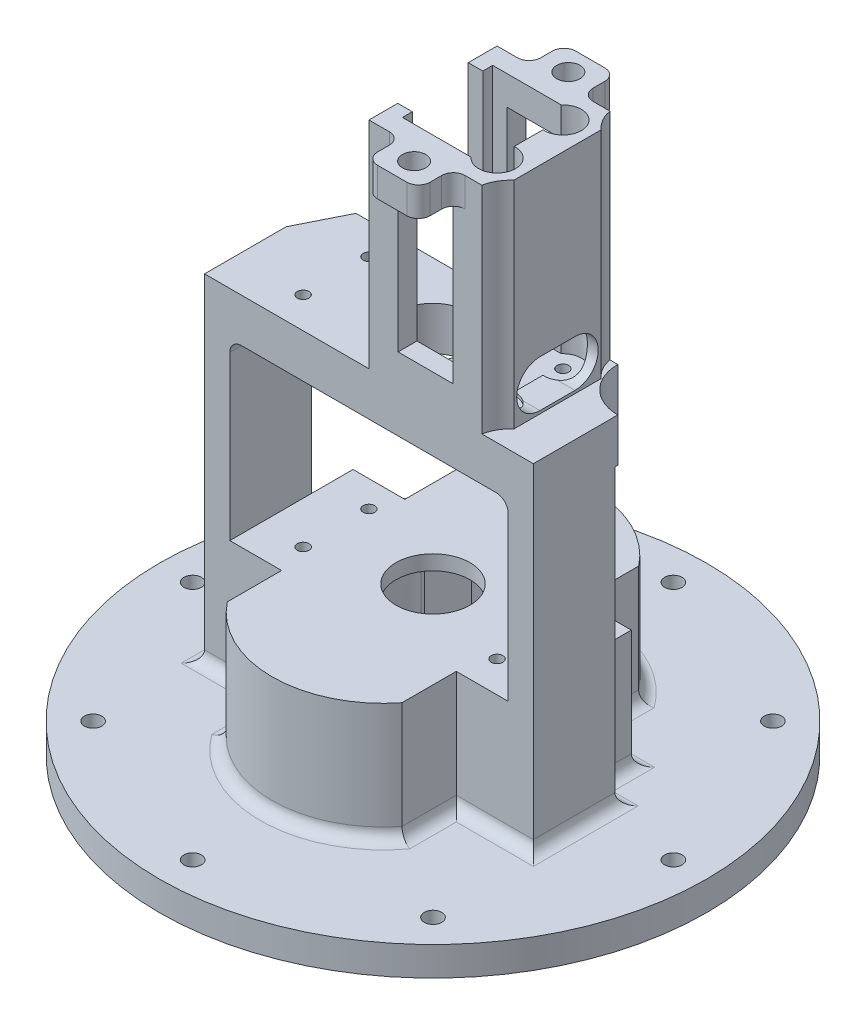
from build123d import *

# Parameters (mm, degrees)
SKETCH2_W                = 8.89
SKETCH2_H                = 20.32
SKETCH2_R                = 12.7
BOSS_EXTRUDE2_DEPTH      = 25.4
SKETCH4_R                = 12.7
CUT_EXTRUDE1_DEPTH       = 22.86
BOSS_EXTRUDE3_DEPTH      = 22.86
FILLET2_R                = 0.508
SKETCH6_R                = 46.99
BOSS_EXTRUDE4_DEPTH      = 5
SKETCH7_R                = 25.781
CUT_EXTRUDE2_DEPTH       = 2
BOSS_EXTRUDE5_START      = -2.54
SKETCH8_R                = 12.7
SKETCH8_R_2              = 6.35
BOSS_EXTRUDE5_DEPTH      = 2.54
SKETCH16_R               = 1.5
CUT_EXTRUDE5_DEPTH       = 72.142674957
BOSS_EXTRUDE6_DEPTH      = 20.4
BOSS_EXTRUDE6_2_DEPTH    = 20.4
SKETCH21_4_W             = 4.34
SKETCH21_4_H             = 14
BOSS_EXTRUDE7_DEPTH      = 30
SKETCH23_R               = 6
BOSS_EXTRUDE8_DEPTH      = 7.5
BOSS_EXTRUDE9_DEPTH      = 7.5
BOSS_EXTRUDE10_DEPTH     = 37
SKETCH30_W               = 9.4
SKETCH30_H               = 27
CUT_EXTRUDE9_DEPTH       = 10
SKETCH31_W               = 9.4
SKETCH31_H               = 27
CUT_EXTRUDE10_DEPTH      = 10
SKETCH28_W               = 9
SKETCH28_H               = 6
SKETCH28_R               = 2
BOSS_EXTRUDE11_DEPTH     = 5
CUT_EXTRUDE16_DEPTH      = 51.054
CUT_EXTRUDE16_DEPTH_BACK = 47
SKETCH32_5_R             = 1
BOSS_EXTRUDE14_DEPTH     = 37
FILLET1_START            = 55.4
FILLET1_DEPTH            = 45.6
FILLET1_START_2          = 94.9
FILLET1_2_DEPTH          = 5
SKETCH39_R               = 3.175
CUT_EXTRUDE18_DEPTH      = 50
SKETCH14_R               = 34.9758
SKETCH14_R_2             = 33.1978
CUT_EXTRUDE19_DEPTH      = 0.508
FILLET3_R                = 2
SKETCH41_W               = 20.57859909
SKETCH41_H               = 5.977801458
CUT_EXTRUDE20_DEPTH      = 2.5
CUT_EXTRUDE23_REACH      = 131.866
FILLET4_R                = 2


with BuildPart() as part:
    # Sketch2 → Boss-Extrude2 (new body)
    # profile 1 of 3: a face of its own
    with BuildSketch(Plane(origin=(0, 0, 0), x_dir=(1, 0, 0), z_dir=(0, 1, 0))):
        with Locations((-19.445, 0)):
            Rectangle(SKETCH2_W, SKETCH2_H)
    # profile 2 of 3: a face of its own
    with BuildSketch(Plane(origin=(0, 0, 0), x_dir=(1, 0, 0), z_dir=(0, 1, 0))):
        with Locations((19.445, 0)):
            Rectangle(SKETCH2_W, SKETCH2_H)
    # profile 3 of 3: a face of its own
    with BuildSketch(Plane(origin=(0, 0, 0), x_dir=(1, 0, 0), z_dir=(0, 1, 0))):
        with BuildLine():
            Line((-15, 20.32), (-15, 10.16))
            Line((-15, 10.16), (-15, -10.16))
            Line((-15, -10.16), (-15, -20.32))
            ThreePointArc((-15, -20.32), (0, -27.626810484), (15, -20.32))
            Line((15, -20.32), (15, -10.16))
            Line((15, -10.16), (15, 10.16))
            Line((15, 10.16), (15, 20.32))
            ThreePointArc((15, 20.32), (0, 27.626810484), (-15, 20.32))
        make_face()
        with Locations(Location((0, 0, 0), (0, 0, 270))):
            Circle(SKETCH2_R, mode=Mode.SUBTRACT)
    extrude(amount=BOSS_EXTRUDE2_DEPTH)

    # Sketch4 → Cut-Extrude1 (cut)
    with BuildSketch(Plane.XZ):
        with BuildLine():
            Line((-12.968, 19.596942063), (-12.968, -19.596942063))
            ThreePointArc((-12.968, -19.596942063), (0, -25.594810484), (12.968, -19.596942063))
            Line((12.968, -19.596942063), (12.968, 19.596942063))
            ThreePointArc((12.968, 19.596942063), (0, 25.594810484), (-12.968, 19.596942063))
        make_face()
        with Locations(Location((0, 0, 0), (0, 0, 270))):
            Circle(SKETCH4_R, mode=Mode.SUBTRACT)
    extrude(amount=-CUT_EXTRUDE1_DEPTH, mode=Mode.SUBTRACT)

    # Sketch5 → Boss-Extrude3 (add)
    with BuildSketch(Plane.XZ.offset(-22.86)):
        with BuildLine():
            Line((-12.968, -8.89), (-9.416496164, -8.89))
            ThreePointArc((-9.416496164, -8.89), (-12.95, 0), (-9.416496164, 8.89))
            Line((-9.416496164, 8.89), (-12.968, 8.89))
            Line((-12.968, 8.89), (-12.968, -8.89))
        make_face()
        with BuildLine():
            Line((9.416496164, -8.89), (12.968, -8.89))
            Line((12.968, -8.89), (12.968, 8.89))
            Line((12.968, 8.89), (9.416496164, 8.89))
            ThreePointArc((9.416496164, 8.89), (12.034245413, 4.783245482), (12.95, 0))
            ThreePointArc((12.95, 0), (12.034245413, -4.783245482), (9.416496164, -8.89))
        make_face()
    extrude(amount=BOSS_EXTRUDE3_DEPTH)

    # Fillet2
    fillet2_edges = [part.edges().sort_by_distance(p)[0] for p in [
        (-9.416496164, 11.43, 8.89),
        (-9.416496164, 11.43, -8.89),
        (9.416496164, 11.43, 8.89),
        (9.416496164, 11.43, -8.89),
    ]]
    fillet(fillet2_edges, radius=FILLET2_R)

    # Sketch6 → Boss-Extrude4 (add)
    with BuildSketch(Plane(origin=(0, 0, 0), x_dir=(1, 0, 0), z_dir=(0, 1, 0))):
        with Locations(Location((0, 0, 0), (0, 0, 270))):
            Circle(SKETCH6_R)
        with BuildLine():
            Line((-23.89, 10.16), (-15, 10.16))
            Line((-15, 10.16), (-15, 20.32))
            ThreePointArc((-15, 20.32), (0, 27.626810484), (15, 20.32))
            Line((15, 20.32), (15, 10.16))
            Line((15, 10.16), (23.89, 10.16))
            Line((23.89, 10.16), (23.89, -10.16))
            Line((23.89, -10.16), (15, -10.16))
            Line((15, -10.16), (15, -20.32))
            ThreePointArc((15, -20.32), (0, -27.626810484), (-15, -20.32))
            Line((-15, -20.32), (-15, -10.16))
            Line((-15, -10.16), (-23.89, -10.16))
            Line((-23.89, -10.16), (-23.89, 10.16))
        make_face(mode=Mode.SUBTRACT)
    extrude(amount=BOSS_EXTRUDE4_DEPTH)

    # Sketch7 → Cut-Extrude2 (cut)
    with BuildSketch(Plane.XZ):
        with Locations(Location((0, 0, 0), (0, 0, 270))):
            Circle(SKETCH7_R)
    extrude(amount=-CUT_EXTRUDE2_DEPTH, mode=Mode.SUBTRACT)

    # Sketch8 → Boss-Extrude5 (add)
    with BuildSketch(Plane(origin=(0, 25.4, 0), x_dir=(1, 0, 0), z_dir=(0, 1, 0)).offset(BOSS_EXTRUDE5_START)):
        Circle(SKETCH8_R)
        with Locations(Location((0, 0, 0), (0, 0, 270))):
            Circle(SKETCH8_R_2, mode=Mode.SUBTRACT)
    extrude(amount=BOSS_EXTRUDE5_DEPTH)

    # Sketch16 → Cut-Extrude5 (cut, through all)
    with BuildSketch(Plane.XZ):
        with Locations(Location((0, 41.275, 0), (0, 0, 270))):
            Circle(SKETCH16_R)
        with Locations(Location((29.185832393, 29.185832393, 0), (0, 0, 270))):
            Circle(SKETCH16_R)
        with Locations(Location((41.275, 0, 0), (0, 0, 270))):
            Circle(SKETCH16_R)
        with Locations(Location((29.185832393, -29.185832393, 0), (0, 0, 270))):
            Circle(SKETCH16_R)
        with Locations(Location((0, -41.275, 0), (0, 0, 270))):
            Circle(SKETCH16_R)
        with Locations(Location((-29.185832393, -29.185832393, 0), (0, 0, 270))):
            Circle(SKETCH16_R)
        with Locations(Location((-41.275, 0, 0), (0, 0, 270))):
            Circle(SKETCH16_R)
        with Locations(Location((-29.185832393, 29.185832393, 0), (0, 0, 270))):
            Circle(SKETCH16_R)
    extrude(amount=-CUT_EXTRUDE5_DEPTH, mode=Mode.SUBTRACT)



with BuildPart() as body_2:
    # Sketch21 → Boss-Extrude6 (new body)
    with BuildSketch(Plane(origin=(0, 25.4, 0), x_dir=(1, 0, 0), z_dir=(0, 1, 0))):
        Polygon((-23.89, 3), (-28.23, 3), (-28.23, -11), (-15, -11), (-15, -10.16), (-23.89, -10.16), align=None)
    extrude(amount=-BOSS_EXTRUDE6_DEPTH)


with BuildPart() as body_3:
    # Sketch21 → Boss-Extrude6 2 (new body)
    with BuildSketch(Plane(origin=(0, 25.4, 0), x_dir=(1, 0, 0), z_dir=(0, 1, 0))):
        Polygon((15, -10.16), (15, -11), (28.23, -11), (28.23, 3), (23.89, 3), (23.89, -10.16), align=None)
    extrude(amount=-BOSS_EXTRUDE6_2_DEPTH)


with BuildPart() as part_1:
    add(part.part)

    add(body_2.part)  # Boss-Extrude7 merges body 2

    add(body_3.part)  # Boss-Extrude7 merges body 3
    # Sketch21<4> → Boss-Extrude7 (add)
    with BuildSketch(Plane(origin=(0, 25.4, 0), x_dir=(1, 0, 0), z_dir=(0, 1, 0))):
        with Locations((-26.06, -4)):
            Rectangle(SKETCH21_4_W, SKETCH21_4_H)
        with Locations((26.06, -4)):
            Rectangle(SKETCH21_4_W, SKETCH21_4_H)
    extrude(amount=BOSS_EXTRUDE7_DEPTH)

    # Sketch23 → Boss-Extrude8 (add)
    with BuildSketch(Plane(origin=(0, 55.4, 0), x_dir=(1, 0, 0), z_dir=(0, 1, 0))):
        with BuildLine():
            Line((-28.23, -11), (28.23, -11))
            Line((28.23, -11), (28.23, 3.5))
            ThreePointArc((28.23, 3.5), (22.926699141, 5.696699141), (20.73, 11))
            Line((20.73, 11), (-24.23, 11))
            Line((-24.23, 11), (-28.23, 3))
            Line((-28.23, 3), (-28.23, -11))
        make_face()
        with Locations(Location((0, 0, 0), (0, 0, 270))):
            Circle(SKETCH23_R, mode=Mode.SUBTRACT)
    extrude(amount=BOSS_EXTRUDE8_DEPTH)

    # Sketch27 → Boss-Extrude9 (add)
    with BuildSketch(Plane.XZ.offset(-55.4)):
        with BuildLine():
            Line((28.23, -3.5), (28.23, -1.976))
            ThreePointArc((28.23, -1.976), (21.946068407, -4.659247122), (19.4, -11))
            Line((19.4, -11), (20.73, -11))
            ThreePointArc((20.73, -11), (22.926699141, -5.696699141), (28.23, -3.5))
        make_face()
    extrude(amount=-BOSS_EXTRUDE9_DEPTH)

    # Sketch25 → Boss-Extrude10 (add)
    with BuildSketch(Plane(origin=(0, 62.9, 0), x_dir=(1, 0, 0), z_dir=(0, 1, 0))):
        Polygon((0, 11), (19.4, 11), (19.4, -11), (0, -11), (0, -6.05), (2.5, -6.05), (2.5, -7.75), (16.4, -7.75), (16.4, 7.75), (2.5, 7.75), (2.5, 6.05), (0, 6.05), align=None)
    extrude(amount=BOSS_EXTRUDE10_DEPTH)

    # Sketch30 → Cut-Extrude9 (cut)
    with BuildSketch(Plane.XY.offset(11)):
        with Locations((9.7, 81.4)):
            Rectangle(SKETCH30_W, SKETCH30_H)
    extrude(amount=-CUT_EXTRUDE9_DEPTH, mode=Mode.SUBTRACT)

    # Sketch31 → Cut-Extrude10 (cut)
    with BuildSketch(Plane(origin=(0, 0, -11), x_dir=(-1, 0, 0), z_dir=(0, 0, -1))):
        with Locations((-9.7, 81.4)):
            Rectangle(SKETCH31_W, SKETCH31_H)
    extrude(amount=-CUT_EXTRUDE10_DEPTH, mode=Mode.SUBTRACT)

    # Sketch28 → Boss-Extrude11 (add)
    # profile 1 of 2: a face of its own
    with BuildSketch(Plane(origin=(0, 99.9, 0), x_dir=(1, 0, 0), z_dir=(0, 1, 0))):
        with Locations((10, 14)):
            Rectangle(SKETCH28_W, SKETCH28_H)
        with Locations(Location((10, 13.25, 0), (0, 0, 270))):
            Circle(SKETCH28_R, mode=Mode.SUBTRACT)
    # profile 2 of 2: a face of its own
    with BuildSketch(Plane(origin=(0, 99.9, 0), x_dir=(1, 0, 0), z_dir=(0, 1, 0))):
        with Locations((10, -14)):
            Rectangle(SKETCH28_W, SKETCH28_H)
        with Locations(Location((10, -13.25, 0), (0, 0, 90))):
            Circle(SKETCH28_R, mode=Mode.SUBTRACT)
    extrude(amount=-BOSS_EXTRUDE11_DEPTH)

    # Sketch32<5> → Cut-Extrude16 (cut, two sides: drawn at the far end of the back side and taken through both)
    with BuildSketch(Plane(origin=(0, 62.9, 0), x_dir=(1, 0, 0), z_dir=(0, 1, 0)).offset(-CUT_EXTRUDE16_DEPTH_BACK)):
        with Locations(Location((-16.65, 5.65, 0), (0, 0, 270))):
            Circle(SKETCH32_5_R)
        with Locations(Location((-16.65, -5.65, 0), (0, 0, 270))):
            Circle(SKETCH32_5_R)
        with Locations(Location((16.65, -5.65, 0), (0, 0, 104.477512186))):
            Circle(SKETCH32_5_R)
        with Locations(Location((16.65, 5.65, 0), (0, 0, 104.477512186))):
            Circle(SKETCH32_5_R)
    extrude(amount=CUT_EXTRUDE16_DEPTH + CUT_EXTRUDE16_DEPTH_BACK, mode=Mode.SUBTRACT)

    # Sketch35 → Boss-Extrude14 (add)
    with BuildSketch(Plane(origin=(0, 99.9, 0), x_dir=(1, 0, 0), z_dir=(0, 1, 0))):
        with BuildLine():
            Line((21.4, 7.471922323), (21.4, -7.528077677))
            ThreePointArc((21.4, -7.528077677), (20.101621006, -9.092157692), (19.4, -11))
            Line((19.4, -11), (19.4, 10.943844647))
            ThreePointArc((19.4, 10.943844647), (20.101621006, 9.036002339), (21.4, 7.471922323))
        make_face()
    extrude(amount=-BOSS_EXTRUDE14_DEPTH)

    # Fillet1: read off the stored shape, not the designer's step
    # Fillet1 outline → Fillet1 (cut)
    with BuildSketch(Plane(origin=(0, 0, 0), x_dir=(1, 0, 0), z_dir=(0, 1, 0)).offset(FILLET1_START)):
        with BuildLine():
            ThreePointArc((5.5, 15), (6.085786438, 16.414213562), (7.5, 17))
            Line((7.5, 17), (5.5, 17))
            Line((5.5, 17), (5.5, 15))
        make_face()
        with BuildLine():
            Line((14.5, 17), (12.5, 17))
            ThreePointArc((12.5, 17), (13.914213562, 16.414213562), (14.5, 15))
            Line((14.5, 15), (14.5, 17))
        make_face()
        with BuildLine():
            Line((14.5, -17), (14.5, -15))
            ThreePointArc((14.5, -15), (13.914213562, -16.414213562), (12.5, -17))
            Line((12.5, -17), (14.5, -17))
        make_face()
        with BuildLine():
            Line((5.5, -17), (7.5, -17))
            ThreePointArc((7.5, -17), (6.085786438, -16.414213562), (5.5, -15))
            Line((5.5, -15), (5.5, -17))
        make_face()
    extrude(amount=FILLET1_DEPTH, mode=Mode.SUBTRACT)

    # Fillet1 2 outline → Fillet1 2 (add)
    with BuildSketch(Plane(origin=(0, 0, 0), x_dir=(1, 0, 0), z_dir=(0, 1, 0)).offset(FILLET1_START_2)):
        with BuildLine():
            Line((5.5, 11), (5.5, 13))
            ThreePointArc((5.5, 13), (4.914213562, 11.585786438), (3.5, 11))
            Line((3.5, 11), (5.5, 11))
        make_face()
        with BuildLine():
            ThreePointArc((16.5, 11), (15.085786438, 11.585786438), (14.5, 13))
            Line((14.5, 13), (14.5, 11))
            Line((14.5, 11), (16.5, 11))
        make_face()
        with BuildLine():
            Line((14.5, -11), (14.5, -13))
            ThreePointArc((14.5, -13), (15.085786438, -11.585786438), (16.5, -11))
            Line((16.5, -11), (14.5, -11))
        make_face()
        with BuildLine():
            Line((5.5, -13), (5.5, -11))
            Line((5.5, -11), (3.5, -11))
            ThreePointArc((3.5, -11), (4.914213562, -11.585786438), (5.5, -13))
        make_face()
    extrude(amount=FILLET1_2_DEPTH)

    # Sketch39 → Cut-Extrude18 (cut)
    with BuildSketch(Plane(origin=(0, 62.9, 0), x_dir=(1, 0, 0), z_dir=(0, 1, 0))):
        with Locations((16.65, 5.65)):
            Circle(SKETCH39_R)
        with Locations((16.65, -5.65)):
            Circle(SKETCH39_R)
    extrude(amount=CUT_EXTRUDE18_DEPTH, mode=Mode.SUBTRACT)

    # Sketch14 → Cut-Extrude19 (cut)
    with BuildSketch(Plane.XZ):
        with Locations(Location((0, 0, 0), (0, 0, 270))):
            Circle(SKETCH14_R)
        with Locations(Location((0, 0, 0), (0, 0, 270))):
            Circle(SKETCH14_R_2, mode=Mode.SUBTRACT)
    extrude(amount=-CUT_EXTRUDE19_DEPTH, mode=Mode.SUBTRACT)

    # Fillet3
    fillet3_edges = [part_1.edges().sort_by_distance(p)[0] for p in [
        (-23.89, 55.4, 4),
        (23.89, 55.4, 4),
    ]]
    fillet(fillet3_edges, radius=FILLET3_R)

    # Sketch41 → Cut-Extrude20 (cut)
    with BuildSketch(Plane(origin=(0, 0, -11), x_dir=(-1, 0, 0), z_dir=(0, 0, -1))):
        with Locations((-9.569657721, 58.388900729)):
            Rectangle(SKETCH41_W, SKETCH41_H)
    extrude(amount=-CUT_EXTRUDE20_DEPTH, mode=Mode.SUBTRACT)

    # Cut-Extrude23: up to this face of the body (flat: up to its plane)
    cut_extrude23_end = Plane(part_1.part.faces().sort_by_distance((16.4, 81.4, 0))[0])
    # Sketch44 → Cut-Extrude23 (cut, up to the picked face)
    with BuildSketch(Plane(origin=(21.4, 0, 0), x_dir=(0, 0, -1), z_dir=(1, 0, 0)), mode=Mode.PRIVATE) as cut_extrude23_sk1:
        with BuildLine():
            Line((2.971922323, 63.4), (-3.028077677, 63.4))
            ThreePointArc((-3.028077677, 63.4), (-7.028077677, 67.4), (-3.028077677, 71.4))
            Line((-3.028077677, 71.4), (2.971922323, 71.4))
            ThreePointArc((2.971922323, 71.4), (6.971922323, 67.4), (2.971922323, 63.4))
        make_face()
    cut_extrude23_tool1 = split(extrude(cut_extrude23_sk1.sketch, amount=-CUT_EXTRUDE23_REACH, mode=Mode.PRIVATE), bisect_by=cut_extrude23_end, keep=Keep.BOTH, mode=Mode.PRIVATE)
    add(cut_extrude23_tool1.solids().sort_by(Axis((21.4, 67.4, 0.028078), (-1, 0, 0)))[0], mode=Mode.SUBTRACT)

    # Fillet4
    fillet4_edges = [part_1.edges().sort_by_distance(p)[0] for p in [
        (0, 5, 27.626810484),
        (-23.89, 5, -6.58),
        (0, 5, -27.626810484),
        (15, 5, -15.24),
        (15, 5, 15.66),
        (-19.445, 5, -10.16),
        (-15, 5, -15.24),
        (19.445, 5, -10.16),
        (23.89, 5, -6.58),
        (28.23, 5, 4),
        (26.06, 5, -3),
        (21.615, 5, 11),
        (-15, 5, 15.66),
        (-26.06, 5, -3),
        (-21.615, 5, 11),
        (-28.23, 5, 4),
    ]]
    fillet(fillet4_edges, radius=FILLET4_R)


solid = part_1.part
